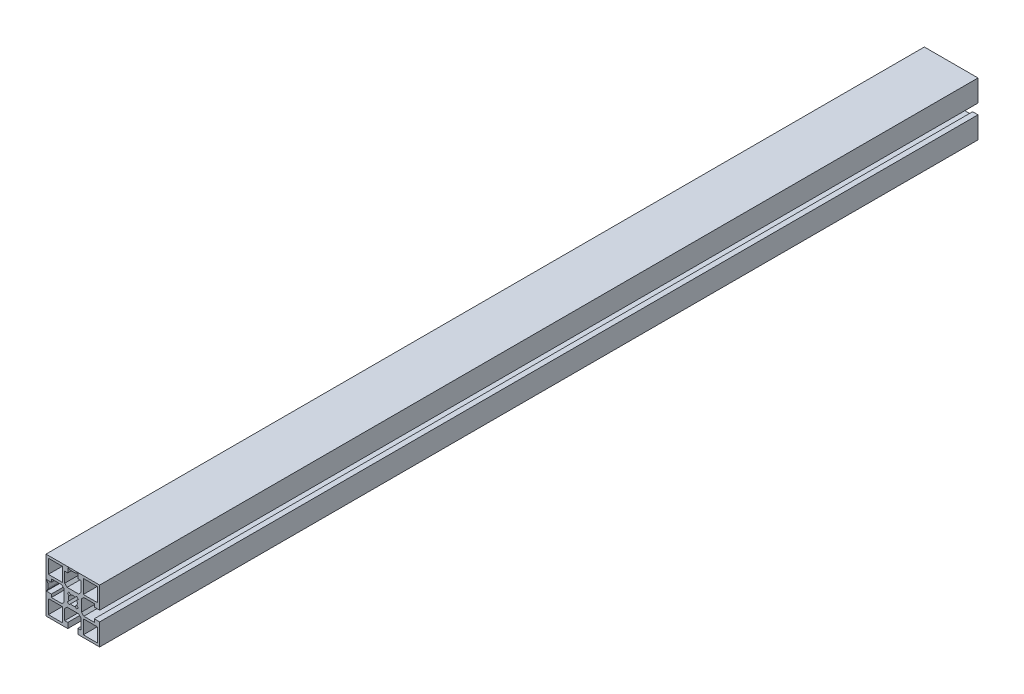
from build123d import *

# Parameters (mm, degrees)
SKETCH1_W           = 11.699975178
SKETCH1_H           = 11.699996949
SKETCH1_W_2         = 11.699990436
SKETCH1_H_2         = 11.699981689
SKETCH1_W_3         = 11.699990437
SKETCH1_H_3         = 11.699975177
SKETCH1_W_4         = 11.699981689
SKETCH1_H_4         = 11.699990436
BOSS_EXTRUDE1_DEPTH = 736.6


with BuildPart() as part:
    # Sketch1 → Boss-Extrude1 (new body)
    with BuildSketch(Plane.XY):
        Polygon((22.500515052, 22.499297556), (-22.499484399, 22.499298105), (-22.499484948, -22.500701346), (-4.249491942, -22.500701568), (-4.249491942, -22.200733242), (-4.24949208, -18.000719999), (-6.799479919, -18.000719999), (-6.799480207, -9.200732353), (-4.799480391, -7.200732362), (4.800525817, -7.200732047), (6.8005258, -9.200731855), (6.800526088, -18.000720263), (4.250507877, -18.000720263), (4.250508015, -22.200733153), (4.250508015, -22.500701672), (22.500514502, -22.500701895), (22.500514725, -4.250714302), (22.200520351, -4.250714302), (18.000507108, -4.25071444), (18.000507108, -6.800702279), (9.200519462, -6.800702567), (7.200519471, -4.800702751), (7.200519156, 4.799303458), (9.200518964, 6.79930344), (18.000507424, 6.799303729), (18.000507424, 4.249285514), (22.200520261, 4.249285652), (22.500514829, 4.249285652), align=None)
        with BuildLine():
            Line((-4.249491247, 17.999291576), (-4.249490956, 22.199304807))
            Line((-4.249490956, 22.199304807), (-3.949472548, 22.199304807))
            Line((-3.949472548, 22.199304807), (-3.481695222, 21.73152644))
            ThreePointArc((-3.481695222, 21.73152644), (-2.670636178, 21.189593132), (-1.713926324, 20.999291428))
            Line((-1.713926324, 20.999291428), (1.714975167, 20.999291428))
            ThreePointArc((1.714975167, 20.999291428), (2.671722509, 21.189608628), (3.482801459, 21.731583767))
            Line((3.482801459, 21.731583767), (3.950490798, 22.199304487))
            Line((3.950490798, 22.199304487), (4.250509108, 22.199304487))
            Line((4.250509108, 22.199304487), (4.250508817, 17.999291575))
            Line((4.250508817, 17.999291575), (6.800527063, 17.999291575))
            Line((6.800527063, 17.999291575), (6.800526453, 9.199302988))
            Line((6.800526453, 9.199302988), (4.800526064, 7.199302969))
            Line((4.800526064, 7.199302969), (-4.799479817, 7.199303635))
            Line((-4.799479817, 7.199303635), (-6.799479854, 9.199304042))
            Line((-6.799479854, 9.199304042), (-6.799479244, 17.999291576))
            Line((-6.799479244, 17.999291576), (-4.249491247, 17.999291576))
        make_face(mode=Mode.SUBTRACT)
        with BuildLine():
            Line((-17.99949762, -4.250714253), (-22.199510799, -4.250714391))
            Line((-22.199510799, -4.250714391), (-22.199510799, -3.950696126))
            Line((-22.199510799, -3.950696126), (-21.731790056, -3.48300681))
            ThreePointArc((-21.731790056, -3.48300681), (-21.189814855, -2.671927844), (-20.999497617, -1.71518046))
            Line((-20.999497617, -1.71518046), (-20.999497617, 1.713721031))
            ThreePointArc((-20.999497617, 1.713721031), (-21.189799286, 2.670430863), (-21.731732544, 3.481489907))
            Line((-21.731732544, 3.481489907), (-22.199510888, 3.949267256))
            Line((-22.199510888, 3.949267256), (-22.199510888, 4.249285566))
            Line((-22.199510888, 4.249285566), (-17.999497356, 4.249285704))
            Line((-17.999497356, 4.249285704), (-17.999497356, 6.79927354))
            Line((-17.999497356, 6.79927354), (-9.199509947, 6.799273828))
            Line((-9.199509947, 6.799273828), (-7.199509956, 4.799274012))
            Line((-7.199509956, 4.799274012), (-7.199509641, -4.800732197))
            Line((-7.199509641, -4.800732197), (-9.199509449, -6.800732179))
            Line((-9.199509449, -6.800732179), (-17.99949762, -6.800732468))
            Line((-17.99949762, -6.800732468), (-17.99949762, -4.250714253))
        make_face(mode=Mode.SUBTRACT)
        with Locations((-14.649542346, -14.650709384)):
            Rectangle(SKETCH1_W, SKETCH1_H, mode=Mode.SUBTRACT)
        with Locations((14.65050626, -14.650767962)):
            Rectangle(SKETCH1_W_2, SKETCH1_H_2, mode=Mode.SUBTRACT)
        with BuildLine():
            Line((-3.181457266, -4.596908447), (-4.595670829, -3.182694885))
            Line((-4.595670829, -3.182694885), (-3.26221457, -1.849238626))
            ThreePointArc((-3.26221457, -1.849238626), (-3.749476751, -0.00071437), (-3.26221457, 1.847809887))
            Line((-3.26221457, 1.847809887), (-4.595670829, 3.181266146))
            Line((-4.595670829, 3.181266146), (-3.181457266, 4.595479708))
            Line((-3.181457266, 4.595479708), (-1.848001007, 3.262023449))
            ThreePointArc((-1.848001007, 3.262023449), (0.000523249, 3.74928563), (1.849047505, 3.262023449))
            Line((1.849047505, 3.262023449), (3.182503764, 4.595479708))
            Line((3.182503764, 4.595479708), (4.596717327, 3.181266146))
            Line((4.596717327, 3.181266146), (3.263261068, 1.847809887))
            ThreePointArc((3.263261068, 1.847809887), (3.750523249, -0.00071437), (3.263261068, -1.849238626))
            Line((3.263261068, -1.849238626), (4.596717327, -3.182694885))
            Line((4.596717327, -3.182694885), (3.182503764, -4.596908447))
            Line((3.182503764, -4.596908447), (1.849047505, -3.263452188))
            ThreePointArc((1.849047505, -3.263452188), (0.000523249, -3.75071437), (-1.848001007, -3.263452188))
            Line((-1.848001007, -3.263452188), (-3.181457266, -4.596908447))
        make_face(mode=Mode.SUBTRACT)
        with Locations((-14.64949028, 14.649335967)):
            Rectangle(SKETCH1_W_3, SKETCH1_H_3, mode=Mode.SUBTRACT)
        with Locations((14.650561583, 14.6492839)):
            Rectangle(SKETCH1_W_4, SKETCH1_H_4, mode=Mode.SUBTRACT)
    extrude(amount=BOSS_EXTRUDE1_DEPTH)


solid = part.part
